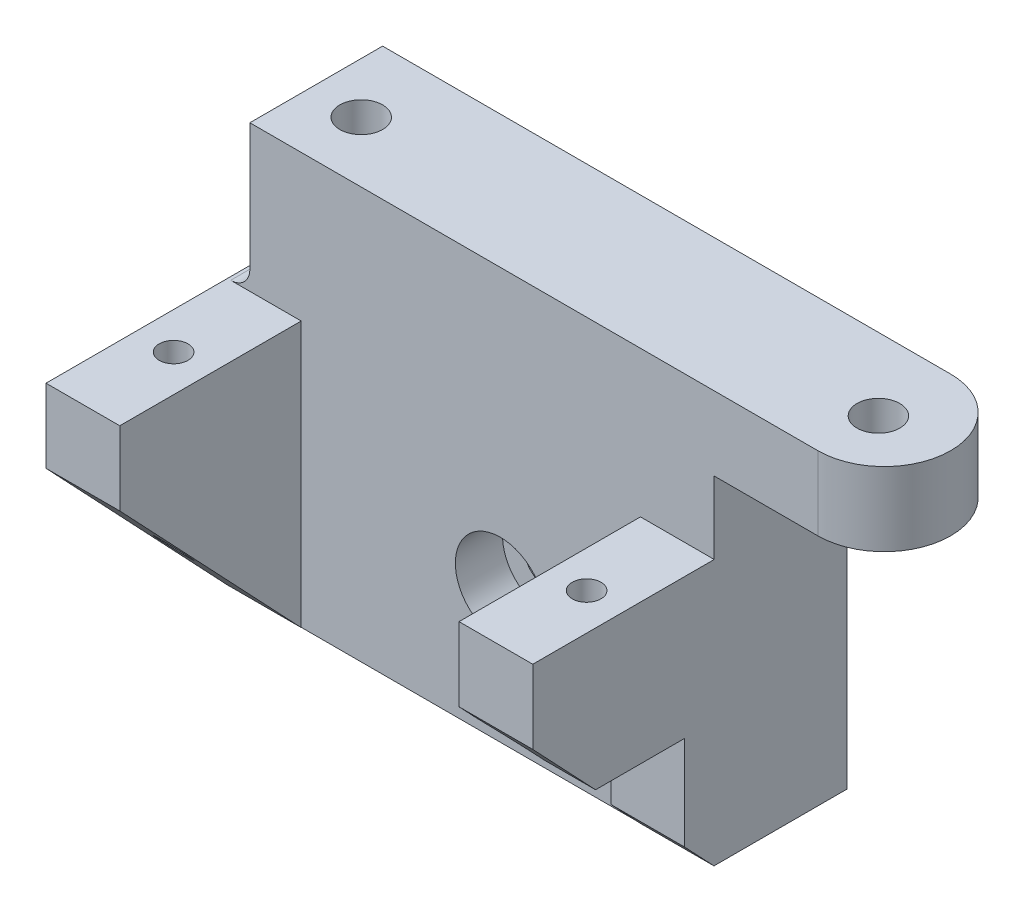
from build123d import *

# Parameters (mm, degrees)
SKETCH1_W               = 33
SKETCH1_H               = 17.983376384
BOSS_EXTRUDE1_DEPTH     = 9
SKETCH4_W               = 5
SKETCH4_H               = 12.3
BOSS_EXTRUDE2_DEPTH     = 5
CHAMFER1_SIZE           = 13
CHAMFER1_SIZE_2         = 12.3
SKETCH2_R               = 1.575
CUT_EXTRUDE1_DEPTH      = 29.404057044
CUT_EXTRUDE2_DEPTH      = 23.458638795
CUT_EXTRUDE2_DEPTH_BACK = 3.2
SKETCH3_R               = 3.05
CUT_EXTRUDE3_REACH      = 34.394
SKETCH5_R               = 0.975
SKETCH6_W               = 33
SKETCH6_H               = 9
BOSS_EXTRUDE3_DEPTH     = 9.9
CUT_EXTRUDE4_START      = 2
CUT_EXTRUDE4_DEPTH      = 8
SKETCH8_R               = 1.45
CUT_EXTRUDE5_DEPTH      = 10
SKETCH9_R               = 1.45
BOSS_EXTRUDE4_DEPTH     = 5
SKETCH10_W              = 1.52
SKETCH10_H              = 9.9
CUT_EXTRUDE6_DEPTH      = 9
FILLET1_R               = 1.3


with BuildPart() as part:
    # Sketch1 → Boss-Extrude1 (new body)
    with BuildSketch(Plane.XY):
        Rectangle(SKETCH1_W, SKETCH1_H)
    extrude(amount=BOSS_EXTRUDE1_DEPTH)

    # Sketch4 → Boss-Extrude2 (add)
    with BuildSketch(Plane(origin=(0, 8.991688192, 0), x_dir=(1, 0, 0), z_dir=(0, 1, 0))):
        with Locations((-14, -15.15)):
            Rectangle(SKETCH4_W, SKETCH4_H)
        with Locations((14, -15.15)):
            Rectangle(SKETCH4_W, SKETCH4_H)
    extrude(amount=-BOSS_EXTRUDE2_DEPTH)

    # Chamfer1
    # the kernel refuses this chamfer: 13, 12.3 mm, written as the material it adds along each edge
    with BuildSketch(Plane(origin=(-16.5, 3.991688192, 9), x_dir=(0, -0.9996433463604261, -0.02670543160724426), z_dir=(1, 0, 0))) as chamfer1_piece_1_section:
        Polygon((CHAMFER1_SIZE * 0.99964334636, -CHAMFER1_SIZE * 0.0267054316072), (-CHAMFER1_SIZE_2 * 0.0267054316072, -CHAMFER1_SIZE_2 * 0.99964334636), (0, 0), align=None)
    chamfer1_piece_1 = extrude(amount=5, mode=Mode.PRIVATE)
    chamfer1_piece_1 = split(chamfer1_piece_1, bisect_by=Plane(origin=(-14, -8.991688192, 13.04185716), z_dir=(0, 1, 0)), keep=Keep.TOP, mode=Mode.PRIVATE)
    chamfer1_piece_1 = split(chamfer1_piece_1, bisect_by=Plane(origin=(-14, -0.292838715, 21.3), z_dir=(0, 0, -1)), keep=Keep.TOP, mode=Mode.PRIVATE)
    add(chamfer1_piece_1)
    with BuildSketch(Plane(origin=(-16.5, 3.991688192, 9), x_dir=(0, -0.9996433463604261, -0.02670543160724426), z_dir=(1, 0, 0))) as chamfer1_piece_2_section:
        Polygon((CHAMFER1_SIZE * 0.99964334636, -CHAMFER1_SIZE * 0.0267054316072), (-CHAMFER1_SIZE_2 * 0.0267054316072, -CHAMFER1_SIZE_2 * 0.99964334636), (0, 0), align=None)
    chamfer1_piece_2 = extrude(amount=38.456243217, mode=Mode.PRIVATE)
    chamfer1_piece_2 = split(chamfer1_piece_2, bisect_by=Plane(origin=(14, -8.991688192, 13.04185716), z_dir=(0, 1, 0)), keep=Keep.TOP, mode=Mode.PRIVATE)
    chamfer1_piece_2 = split(chamfer1_piece_2, bisect_by=Plane(origin=(16.5, -0.292838715, 13.04185716), z_dir=(-1, 0, 0)), keep=Keep.TOP, mode=Mode.PRIVATE)
    chamfer1_piece_2 = split(chamfer1_piece_2, bisect_by=Plane(origin=(11.5, -0.292838715, 13.04185716), z_dir=(1, 0, 0)), keep=Keep.TOP, mode=Mode.PRIVATE)
    chamfer1_piece_2 = split(chamfer1_piece_2, bisect_by=Plane(origin=(14, -0.292838715, 21.3), z_dir=(0, 0, -1)), keep=Keep.TOP, mode=Mode.PRIVATE)
    add(chamfer1_piece_2)
    with BuildSketch(Plane(origin=(16.5, 3.991688192, 9), x_dir=(0, -0.9996433463604261, -0.02670543160724426), z_dir=(-1, 0, 0))) as chamfer1_piece_3_section:
        Polygon((CHAMFER1_SIZE * 0.99964334636, CHAMFER1_SIZE * 0.0267054316072), (-CHAMFER1_SIZE_2 * 0.0267054316072, CHAMFER1_SIZE_2 * 0.99964334636), (0, 0), align=None)
    chamfer1_piece_3 = extrude(amount=5, mode=Mode.PRIVATE)
    chamfer1_piece_3 = split(chamfer1_piece_3, bisect_by=Plane(origin=(14, -8.991688192, 13.04185716), z_dir=(0, 1, 0)), keep=Keep.TOP, mode=Mode.PRIVATE)
    chamfer1_piece_3 = split(chamfer1_piece_3, bisect_by=Plane(origin=(14, -0.292838715, 21.3), z_dir=(0, 0, -1)), keep=Keep.TOP, mode=Mode.PRIVATE)
    add(chamfer1_piece_3)
    with BuildSketch(Plane(origin=(16.5, 3.991688192, 9), x_dir=(0, -0.9996433463604261, -0.02670543160724426), z_dir=(-1, 0, 0))) as chamfer1_piece_4_section:
        Polygon((CHAMFER1_SIZE * 0.99964334636, CHAMFER1_SIZE * 0.0267054316072), (-CHAMFER1_SIZE_2 * 0.0267054316072, CHAMFER1_SIZE_2 * 0.99964334636), (0, 0), align=None)
    chamfer1_piece_4 = extrude(amount=38.456243217, mode=Mode.PRIVATE)
    chamfer1_piece_4 = split(chamfer1_piece_4, bisect_by=Plane(origin=(-14, -8.991688192, 13.04185716), z_dir=(0, 1, 0)), keep=Keep.TOP, mode=Mode.PRIVATE)
    chamfer1_piece_4 = split(chamfer1_piece_4, bisect_by=Plane(origin=(-16.5, -0.292838715, 13.04185716), z_dir=(1, 0, 0)), keep=Keep.TOP, mode=Mode.PRIVATE)
    chamfer1_piece_4 = split(chamfer1_piece_4, bisect_by=Plane(origin=(-14, -0.292838715, 21.3), z_dir=(0, 0, -1)), keep=Keep.TOP, mode=Mode.PRIVATE)
    chamfer1_piece_4 = split(chamfer1_piece_4, bisect_by=Plane(origin=(-11.5, -0.292838715, 13.04185716), z_dir=(-1, 0, 0)), keep=Keep.TOP, mode=Mode.PRIVATE)
    add(chamfer1_piece_4)

    # Sketch2 → Cut-Extrude1 (cut, through all)
    with BuildSketch(Plane(origin=(0, 0, 0), x_dir=(-1, 0, 0), z_dir=(0, 0, -1))):
        with Locations((-2, 0)):
            Circle(SKETCH2_R)
        with Locations((-10, 0)):
            Circle(SKETCH2_R)
    extrude(amount=-CUT_EXTRUDE1_DEPTH, mode=Mode.SUBTRACT)

    # Sketch3 → Cut-Extrude2 (cut, two sides: drawn at the far end of the back side and taken through both)
    with BuildSketch(Plane.XY.offset(9).offset(-CUT_EXTRUDE2_DEPTH_BACK)):
        with Locations((2, 0)):
            Circle(SKETCH3_R)
        with Locations(Location((10, 0, 0), (0, 0, 60.540825088))):
            Circle(SKETCH3_R)
    extrude(amount=CUT_EXTRUDE2_DEPTH + CUT_EXTRUDE2_DEPTH_BACK, mode=Mode.SUBTRACT)

    # Cut-Extrude3: up to this plane
    cut_extrude3_end = Plane(origin=(0, -9.008311808, 9), z_dir=(0, 0.6872795500600087, -0.726393020388627))
    # Sketch5 → Cut-Extrude3 (cut, up to the surface)
    with BuildSketch(Plane(origin=(0, 8.991688192, 0), x_dir=(1, 0, 0), z_dir=(0, 1, 0)), mode=Mode.PRIVATE) as cut_extrude3_sk1:
        with Locations(Location((-14, -15.15, 0), (0, 0, 180))):
            Circle(SKETCH5_R)
    cut_extrude3_tool1 = split(extrude(cut_extrude3_sk1.sketch, amount=-CUT_EXTRUDE3_REACH, mode=Mode.PRIVATE), bisect_by=cut_extrude3_end, keep=Keep.BOTH, mode=Mode.PRIVATE)
    add(cut_extrude3_tool1.solids().sort_by_distance((-14, 8.991688, 15.15))[0], mode=Mode.SUBTRACT)
    # Sketch5 → Cut-Extrude3 (cut, up to the surface)
    with BuildSketch(Plane(origin=(0, 8.991688192, 0), x_dir=(1, 0, 0), z_dir=(0, 1, 0)), mode=Mode.PRIVATE) as cut_extrude3_sk2:
        with Locations(Location((14, -15.15, 0), (0, 0, 270))):
            Circle(SKETCH5_R)
    cut_extrude3_tool2 = split(extrude(cut_extrude3_sk2.sketch, amount=-CUT_EXTRUDE3_REACH, mode=Mode.PRIVATE), bisect_by=cut_extrude3_end, keep=Keep.BOTH, mode=Mode.PRIVATE)
    add(cut_extrude3_tool2.solids().sort_by_distance((14, 8.991688, 15.15))[0], mode=Mode.SUBTRACT)

    # Sketch6 → Boss-Extrude3 (add)
    with BuildSketch(Plane(origin=(0, 8.991688192, 0), x_dir=(1, 0, 0), z_dir=(0, 1, 0))):
        with Locations((0, -4.5)):
            Rectangle(SKETCH6_W, SKETCH6_H)
    extrude(amount=BOSS_EXTRUDE3_DEPTH)

    # Sketch7 → Cut-Extrude4 (cut)
    with BuildSketch(Plane.XY.offset(9).offset(CUT_EXTRUDE4_START)):
        Polygon((11.5, -2.655654345), (11.5, -5.508311808), (16.5, -5.508311808), (16.5, -0.508311808), (11.5, -0.508311808), align=None)
        Polygon((16.5, -5.508311808), (11.5, -5.508311808), (11.5, -8.991688192), (11.5, -10.104288395), (16.5, -10.104288395), align=None)
    extrude(amount=CUT_EXTRUDE4_DEPTH, mode=Mode.SUBTRACT)

    # Sketch8 → Cut-Extrude5 (cut)
    with BuildSketch(Plane(origin=(0, 18.891688192, 0), x_dir=(1, 0, 0), z_dir=(0, 1, 0))):
        with Locations(Location((-11.53, -4.9, 0), (0, 0, 180))):
            Circle(SKETCH8_R)
    cut_extrude5 = extrude(amount=-CUT_EXTRUDE5_DEPTH, mode=Mode.SUBTRACT)

    # Sketch9 → Boss-Extrude4 (add)
    with BuildSketch(Plane(origin=(0, 18.891688192, 0), x_dir=(1, 0, 0), z_dir=(0, 1, 0))):
        with BuildLine():
            Line((-11.53, 0), (-1.44116457, 0))
            ThreePointArc((-1.44116457, 0), (3.05883543, -4.5), (-1.44116457, -9))
            Line((-1.44116457, -9), (-11.53, -9))
            ThreePointArc((-11.53, -9), (-16.03, -4.5), (-11.53, 0))
        make_face()
        with Locations(Location((-11.53, -4.9, 0), (0, 0, 180))):
            Circle(SKETCH9_R, mode=Mode.SUBTRACT)
    boss_extrude4 = extrude(amount=-BOSS_EXTRUDE4_DEPTH)

    # Mirror1: Cut-Extrude5, Boss-Extrude4 across plane
    add(cut_extrude5.mirror(Plane(origin=(6, 0, 0), x_dir=(0, 0, 1), z_dir=(1, 0, 0))), mode=Mode.SUBTRACT)
    add(boss_extrude4.mirror(Plane(origin=(6, 0, 0), x_dir=(0, 0, 1), z_dir=(1, 0, 0))))

    # Sketch10 → Cut-Extrude6 (cut)
    with BuildSketch(Plane(origin=(0, 0, 0), x_dir=(-1, 0, 0), z_dir=(0, 0, -1))):
        with Locations((15.74, 13.941688192)):
            Rectangle(SKETCH10_W, SKETCH10_H)
    extrude(amount=-CUT_EXTRUDE6_DEPTH, mode=Mode.SUBTRACT)

    # Fillet1
    fillet1_edges = [part.edges().sort_by_distance(p)[0] for p in [
        (-14.98, 8.991688192, 4.5),
    ]]
    fillet(fillet1_edges, radius=FILLET1_R)


solid = part.part
